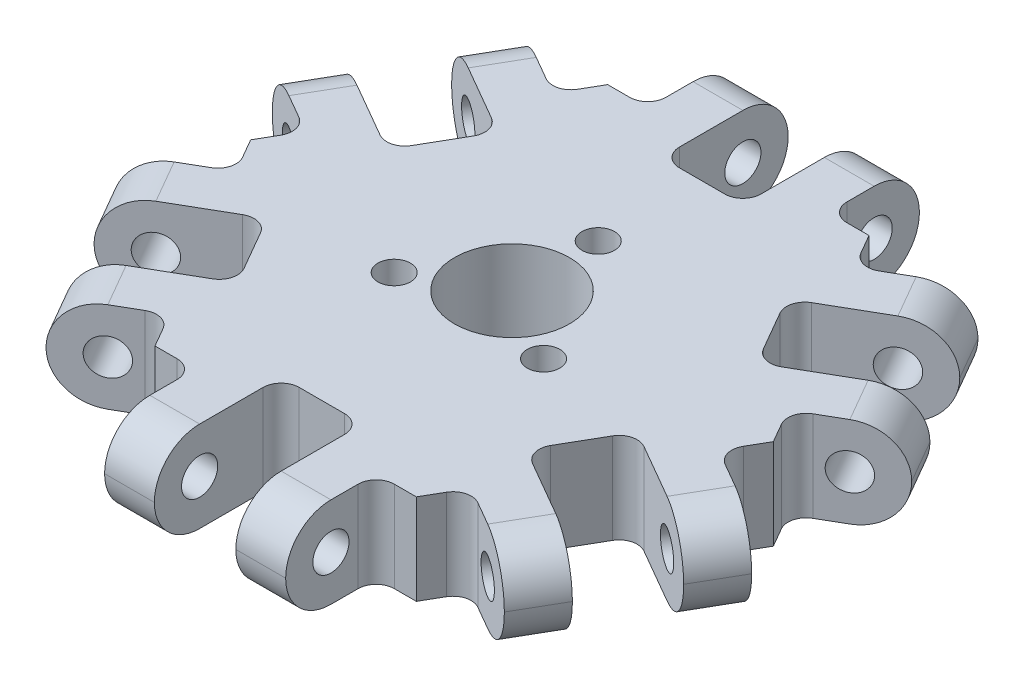
from build123d import *

# Parameters (mm, degrees)
BOSS_EXTRUDE1_DEPTH      = 10
BOSS_EXTRUDE2_DEPTH      = 10
CUT_EXTRUDE1_REACH       = 47.069
FILLET1_R                = 5
F_4_0_MM_DOWEL_HOLES1_D  = 4
CIRPATTERN5_COUNT        = 6
FILLET1_OF_CIRPATTERN5_R = 5
FILLET2_R                = 2
SKETCH6_R                = 6.35
CUT_EXTRUDE2_DEPTH       = 51.71349811760731
M3_CLEARANCE_HOLE1_D     = 3.6
CIRPATTERN6_COUNT        = 3


with BuildPart() as part:
    # Sketch1 → Boss-Extrude1 (new body)
    with BuildSketch(Plane(origin=(0, 0, 0), x_dir=(1, 0, 0), z_dir=(0, 1, 0))):
        Polygon((-28.867513459481238, 4.38e-15), (-14.43375672974066, 25.000000000000057), (14.433756729740656, 25.000000000000057), (28.867513459481245, 6.61e-15), (14.433756729740656, -25.00000000000005), (-14.433756729740653, -25.00000000000005), align=None)
    extrude(amount=BOSS_EXTRUDE1_DEPTH)

    # Sketch2 → Boss-Extrude2 (add)
    with BuildSketch(Plane(origin=(21.650635094611008, 0, 12.49999999999995), x_dir=(0.49999999999999784, 0, -0.86602540378444), z_dir=(0.86602540378444, 0, 0.49999999999999784))):
        Polygon((-10.000000000000002, 10), (9.999999999999998, 10.000000000000004), (10, 3.67e-15), (-10, 0), align=None)
    boss_extrude2 = extrude(amount=BOSS_EXTRUDE2_DEPTH)

    # Sketch3 → Cut-Extrude1 (cut, up to next)
    with BuildSketch(Plane(origin=(0, 10, 0), x_dir=(1, 0, 0), z_dir=(0, 1, 0)), mode=Mode.PRIVATE) as cut_extrude1_sk1:
        Polygon((28.060889132455394, -21.397114317029995), (32.56088913245539, -13.602885682970053), (20.436533479473244, -6.602885682970054), (15.936533479473251, -14.39711431702999), align=None)
    cut_extrude1_tool1 = extrude(cut_extrude1_sk1.sketch, amount=-CUT_EXTRUDE1_REACH, mode=Mode.PRIVATE) & part.part
    cut_extrude1 = cut_extrude1_tool1.solids().sort_by_distance((24.248711, 10, 14))[0]
    add(cut_extrude1, mode=Mode.SUBTRACT)

    # Fillet1
    fillet1_edges = [part.edges().sort_by_distance(p)[0] for p in [
        (26.6858891324554, 5.1e-16, 23.778684177437157),
        (26.6858891324554, 10, 23.778684177437157),
        (33.935889132455365, 3.17e-15, 11.22131582256278),
        (33.935889132455365, 10.000000000000004, 11.22131582256278),
    ]]
    fillet(fillet1_edges, radius=FILLET1_R - 0.0001)  # a hair under: the kernel refuses the full size

    # Ø4.0 mm Dowel Holes1 (through all)
    with Locations(Plane(origin=(-4.999999999999981, -4.74e-15, 8.660254037844405), x_dir=(0.8660254037844399, 0, 0.4999999999999979), z_dir=(-0.49999999999999784, 0, 0.8660254037844398))):
        with Locations((30, 5)):
            f_4_0_mm_dowel_holes1 = Hole(F_4_0_MM_DOWEL_HOLES1_D / 2)

    # CirPattern5: Boss-Extrude2, Cut-Extrude1, Ø4.0 mm Dowel Holes1 ×6 about axis
    cirpattern5_axis = Axis((-8.6e-16, 0, -9.3e-16), (0, 1, 0))
    add([boss_extrude2.rotate(cirpattern5_axis, i * 360 / CIRPATTERN5_COUNT) for i in range(1, CIRPATTERN5_COUNT)])
    add([cut_extrude1.rotate(cirpattern5_axis, i * 360 / CIRPATTERN5_COUNT) for i in range(1, CIRPATTERN5_COUNT)], mode=Mode.SUBTRACT)
    add([f_4_0_mm_dowel_holes1.rotate(cirpattern5_axis, i * 360 / CIRPATTERN5_COUNT) for i in range(1, CIRPATTERN5_COUNT)], mode=Mode.SUBTRACT)

    # Fillet1 of CirPattern5
    fillet1_of_cirpattern5_edges = [part.edges().sort_by_distance(p)[0] for p in [
        (33.93588913245536, 5.1e-16, -11.221315822562872),
        (33.93588913245536, 10, -11.221315822562872),
        (26.685889132455333, 3.17e-15, -23.77868417743721),
        (26.68588913245533, 10.000000000000004, -23.778684177437214),
        (7.24999999999996, 5.1e-16, -35.00000000000003),
        (7.249999999999962, 10, -35.00000000000003),
        (-7.250000000000035, 3.17e-15, -35),
        (-7.250000000000035, 10.000000000000004, -35),
        (-26.6858891324554, 5.1e-16, -23.778684177437164),
        (-26.6858891324554, 10, -23.778684177437164),
        (-33.935889132455365, 3.17e-15, -11.221315822562786),
        (-33.935889132455365, 10.000000000000004, -11.221315822562786),
        (-33.93588913245536, 5.1e-16, 11.221315822562858),
        (-33.935889132455365, 10, 11.221315822562856),
        (-26.685889132455337, 3.17e-15, 23.7786841774372),
        (-26.685889132455337, 10.000000000000004, 23.7786841774372),
        (-7.249999999999951, 5.1e-16, 35.000000000000036),
        (-7.249999999999951, 10, 35.000000000000036),
        (7.250000000000045, 3.17e-15, 34.99999999999999),
        (7.2500000000000435, 10.000000000000004, 34.99999999999999),
    ]]
    fillet(fillet1_of_cirpattern5_edges, radius=FILLET1_OF_CIRPATTERN5_R - 0.0001)  # a hair under: the kernel refuses the full size

    # Fillet2
    fillet2_edges = [part.edges().sort_by_distance(p)[0] for p in [
        (-10.00000000000006, 5.0000000000000036, -24.99999999999999),
        (-16.65063509461103, 5, -21.160254037844354),
        (-26.650635094610987, 5.0000000000000036, -3.839745962155554),
        (-26.65063509461097, 5, 3.839745962155675),
        (-16.650635094610934, 5.0000000000000036, 21.160254037844428),
        (-9.999999999999936, 5, 25.000000000000043),
        (10.000000000000064, 5.0000000000000036, 24.999999999999986),
        (20.436533479473248, 5, -6.602885682970051),
        (15.936533479473255, 5, -14.39711431702999),
        (4.499999999999998, 5, -21.000000000000046),
        (-4.499999999999988, 5, -21.00000000000005),
        (-15.936533479473251, 5, -14.397114317029994),
        (-20.436533479473244, 5, -6.602885682970059),
        (-20.43653347947325, 5, 6.602885682970041),
        (-15.93653347947326, 5, 14.397114317029978),
        (-4.499999999999992, 5, 21.000000000000043),
        (4.499999999999993, 5, 21.000000000000043),
        (16.65063509461103, 5, 21.16025403784435),
        (26.650635094610987, 5.0000000000000036, 3.8397459621555505),
        (15.936533479473251, 5, 14.39711431702999),
        (20.436533479473244, 5, 6.602885682970054),
        (26.65063509461097, 5, -3.8397459621556855),
        (16.650635094610927, 5.0000000000000036, -21.160254037844435),
        (9.999999999999943, 5, -25.00000000000004),
    ]]
    fillet(fillet2_edges, radius=FILLET2_R)

    # Sketch6 → Cut-Extrude2 (cut, through all)
    with BuildSketch(Plane(origin=(0, 10, 0), x_dir=(1, 0, 0), z_dir=(0, 1, 0))):
        with Locations(Location((0, 0, 0), (0, 0, 270))):
            Circle(SKETCH6_R)
    extrude(amount=-CUT_EXTRUDE2_DEPTH, mode=Mode.SUBTRACT)

    # M3 Clearance Hole1 (through all)
    with Locations(Plane(origin=(0, 10, 0), x_dir=(1, 0, 0), z_dir=(0, 1, 0))):
        with Locations((0, 9.525)):
            m3_clearance_hole1 = Hole(M3_CLEARANCE_HOLE1_D / 2)

    # CirPattern6: M3 Clearance Hole1 ×3 about axis
    cirpattern6_axis = Axis((-3.1e-16, 0, 4.7e-16), (0, 1, 0))
    for i in range(1, CIRPATTERN6_COUNT):
        add(m3_clearance_hole1.rotate(cirpattern6_axis, i * 360 / CIRPATTERN6_COUNT), mode=Mode.SUBTRACT)


solid = part.part
